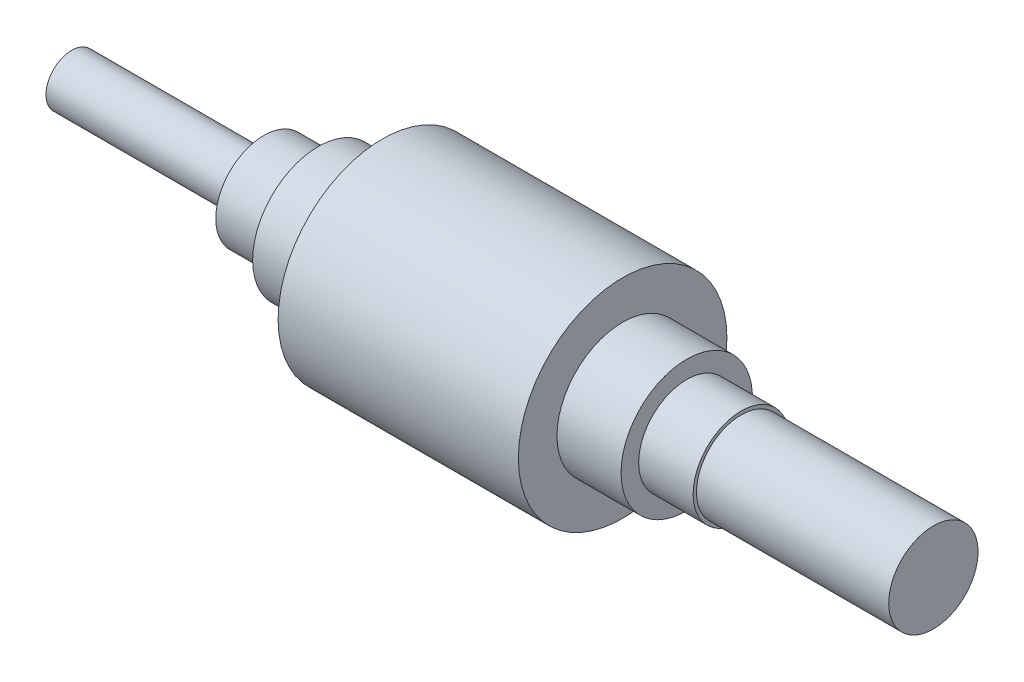
from build123d import *


with BuildPart() as part:
    # Çizim1 → Döndür1 (revolve)
    with BuildSketch(Plane.XY):
        Polygon((30, 7.5), (38.5, 7.5), (38.5, 10.25), (48.5, 10.25), (48.5, 16.275), (86, 16.275), (86, 10.25), (96, 10.25), (96, 7.5), (104.5, 7.5), (104.5, 6.975), (134.5, 6.975), (134.5, 0), (0, 0), (0, 4), (30, 4), align=None)
    revolve(axis=Axis((0, 0, 0), (1, 0, 0)))


solid = part.part
